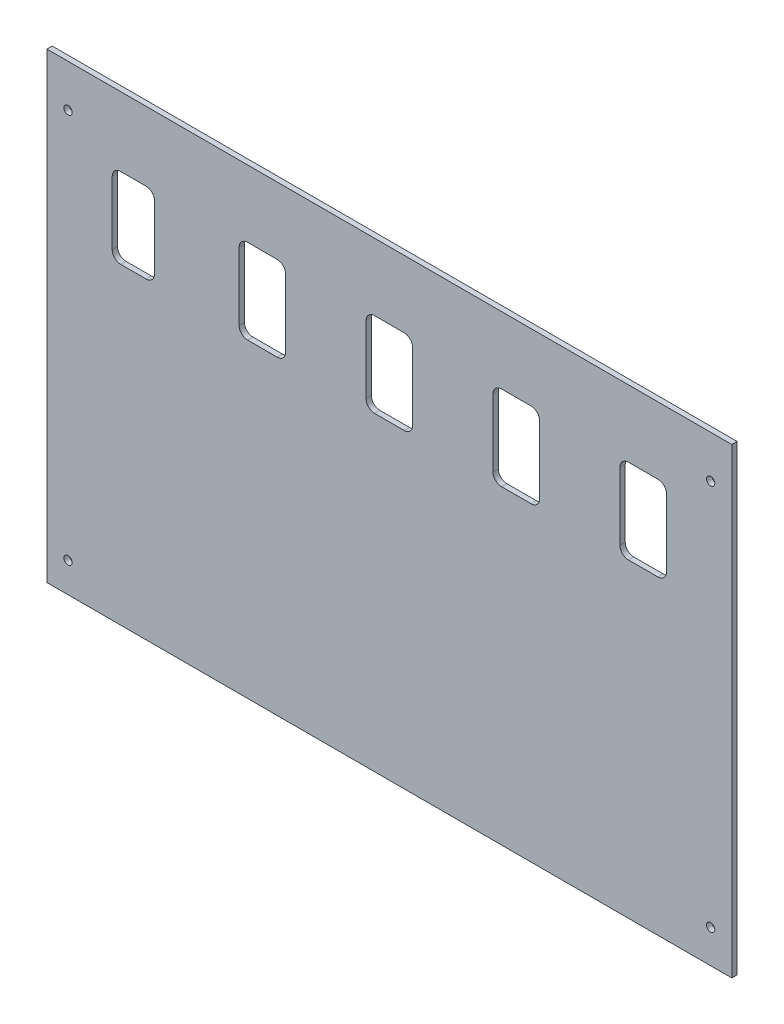
from build123d import *

# Parameters (mm, degrees)
SKETCH3_W              = 411.1625
SKETCH3_H              = 277.368
BOSS_EXTRUDE1_DEPTH    = 1.5875
CUT_EXTRUDE1_DEPTH     = 25.4
F_10_CLEARANCE_HOLE1_D = 4.9784


with BuildPart() as part:
    # Sketch3 → Boss-Extrude1 (new, symmetric)
    with BuildSketch(Plane.XY):
        Rectangle(SKETCH3_W, SKETCH3_H)
    extrude(amount=BOSS_EXTRUDE1_DEPTH, both=True)

    # Sketch4 → Cut-Extrude1 (cut)
    with BuildSketch(Plane.XY.offset(1.5875)):
        with BuildLine():
            Line((8.89, 98.4326708), (-8.89, 98.4326708))
            ThreePointArc((-8.89, 98.4326708), (-12.482102448, 96.944773248), (-13.97, 93.3526708))
            Line((-13.97, 93.3526708), (-13.97, 52.7126708))
            ThreePointArc((-13.97, 52.7126708), (-12.482102448, 49.120568352), (-8.89, 47.6326708))
            Line((-8.89, 47.6326708), (8.89, 47.6326708))
            ThreePointArc((8.89, 47.6326708), (12.482102448, 49.120568352), (13.97, 52.7126708))
            Line((13.97, 52.7126708), (13.97, 93.3526708))
            ThreePointArc((13.97, 93.3526708), (12.482102448, 96.944773248), (8.89, 98.4326708))
        make_face()
        with BuildLine():
            Line((85.09, 98.4326708), (67.31, 98.4326708))
            ThreePointArc((67.31, 98.4326708), (63.717897552, 96.944773248), (62.23, 93.3526708))
            Line((62.23, 93.3526708), (62.23, 52.7126708))
            ThreePointArc((62.23, 52.7126708), (63.717897552, 49.120568352), (67.31, 47.6326708))
            Line((67.31, 47.6326708), (85.09, 47.6326708))
            ThreePointArc((85.09, 47.6326708), (88.682102448, 49.120568352), (90.17, 52.7126708))
            Line((90.17, 52.7126708), (90.17, 93.3526708))
            ThreePointArc((90.17, 93.3526708), (88.682102448, 96.944773248), (85.09, 98.4326708))
        make_face()
        with BuildLine():
            Line((161.29, 98.4326708), (143.51, 98.4326708))
            ThreePointArc((143.51, 98.4326708), (139.917897552, 96.944773248), (138.43, 93.3526708))
            Line((138.43, 93.3526708), (138.43, 52.7126708))
            ThreePointArc((138.43, 52.7126708), (139.917897552, 49.120568352), (143.51, 47.6326708))
            Line((143.51, 47.6326708), (161.29, 47.6326708))
            ThreePointArc((161.29, 47.6326708), (164.882102448, 49.120568352), (166.37, 52.7126708))
            Line((166.37, 52.7126708), (166.37, 93.3526708))
            ThreePointArc((166.37, 93.3526708), (164.882102448, 96.944773248), (161.29, 98.4326708))
        make_face()
        with BuildLine():
            Line((-67.31, 98.4326708), (-85.09, 98.4326708))
            ThreePointArc((-85.09, 98.4326708), (-88.682102448, 96.944773248), (-90.17, 93.3526708))
            Line((-90.17, 93.3526708), (-90.17, 52.7126708))
            ThreePointArc((-90.17, 52.7126708), (-88.682102448, 49.120568352), (-85.09, 47.6326708))
            Line((-85.09, 47.6326708), (-67.31, 47.6326708))
            ThreePointArc((-67.31, 47.6326708), (-63.717897552, 49.120568352), (-62.23, 52.7126708))
            Line((-62.23, 52.7126708), (-62.23, 93.3526708))
            ThreePointArc((-62.23, 93.3526708), (-63.717897552, 96.944773248), (-67.31, 98.4326708))
        make_face()
        with BuildLine():
            Line((-146.05, 97.1626708), (-161.29, 97.1626708))
            ThreePointArc((-161.29, 97.1626708), (-164.882102448, 95.674773248), (-166.37, 92.0826708))
            Line((-166.37, 92.0826708), (-166.37, 53.9826708))
            ThreePointArc((-166.37, 53.9826708), (-164.882102448, 50.390568352), (-161.29, 48.9026708))
            Line((-161.29, 48.9026708), (-146.05, 48.9026708))
            ThreePointArc((-146.05, 48.9026708), (-142.457897552, 50.390568352), (-140.97, 53.9826708))
            Line((-140.97, 53.9826708), (-140.97, 92.0826708))
            ThreePointArc((-140.97, 92.0826708), (-142.457897552, 95.674773248), (-146.05, 97.1626708))
        make_face()
    extrude(amount=-CUT_EXTRUDE1_DEPTH, mode=Mode.SUBTRACT)

    # #10 Clearance Hole1 (through all)
    with Locations(Plane.XY.offset(1.5875)):
        with Locations((192.88125, 113.284), (-192.88125, -120.764157335), (192.88125, -118.647541008), (-192.88125, 113.284)):
            Hole(F_10_CLEARANCE_HOLE1_D / 2)


solid = part.part
